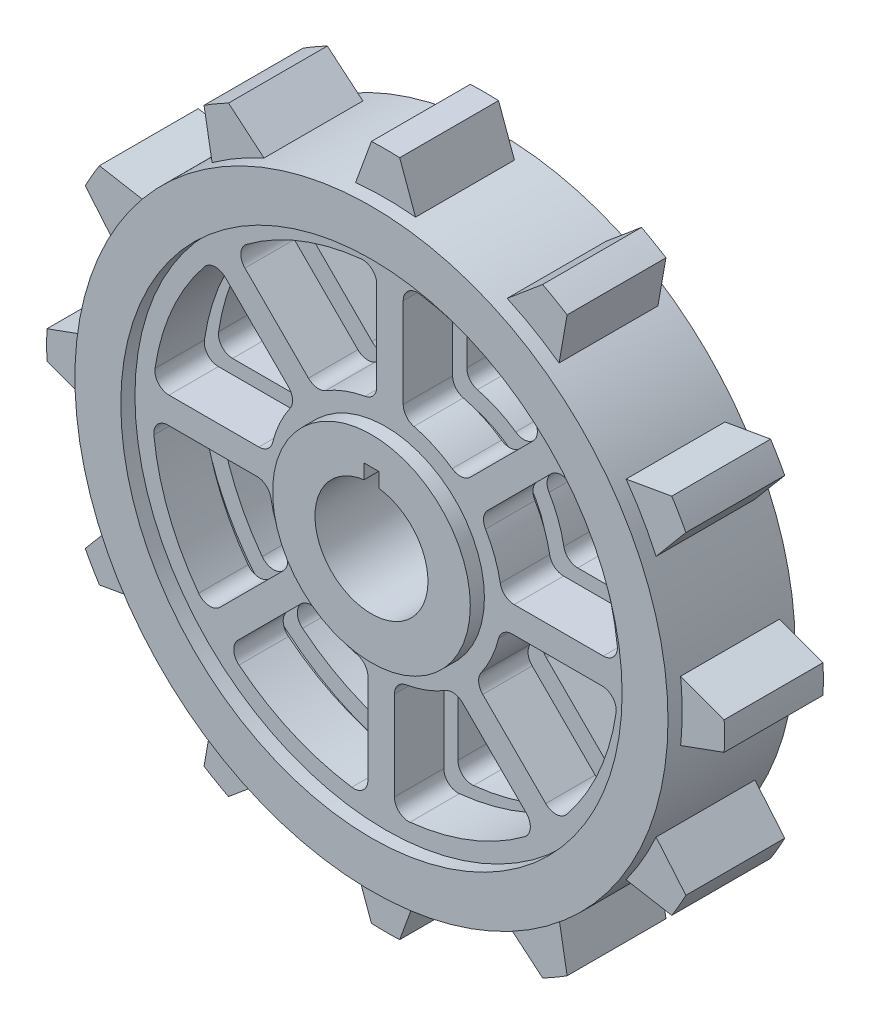
from build123d import *

# Parameters (mm, degrees)
SKETCH3_R                = 21
BOSS_EXTRUDE2_DEPTH      = 4.5
CUT_EXTRUDE1_DEPTH       = 32.032241298
SKETCH5_R                = 17.75
SKETCH5_R_2              = 7
CUT_EXTRUDE5_DEPTH       = 1
SKETCH6_R                = 17.75
SKETCH6_R_2              = 7
CUT_EXTRUDE6_DEPTH       = 1
CUT_EXTRUDE7_DEPTH       = 31.757112998
FILLET1_R                = 1
CIRPATTERN1_COUNT        = 8
FILLET1_OF_CIRPATTERN1_R = 1
BOSS_EXTRUDE3_DEPTH      = 7
CIRPATTERN2_COUNT        = 12


with BuildPart() as part:
    # Sketch3 → Boss-Extrude2 (new, symmetric)
    with BuildSketch(Plane.XY):
        Circle(SKETCH3_R)
    extrude(amount=BOSS_EXTRUDE2_DEPTH, both=True)

    # Sketch4 → Cut-Extrude1 (cut, through all)
    with BuildSketch(Plane.XY.offset(4.5)):
        with BuildLine():
            Line((-0.525, 5), (-0.525, 3.965397206))
            ThreePointArc((-0.525, 3.965397206), (0, -4), (0.525, 3.965397206))
            Line((0.525, 3.965397206), (0.525, 5))
            Line((0.525, 5), (-0.525, 5))
        make_face()
    extrude(amount=-CUT_EXTRUDE1_DEPTH, mode=Mode.SUBTRACT)

    # Sketch5 → Cut-Extrude5 (cut)
    with BuildSketch(Plane.XY):
        Circle(SKETCH5_R)
        Circle(SKETCH5_R_2, mode=Mode.SUBTRACT)
    extrude(amount=-CUT_EXTRUDE5_DEPTH, mode=Mode.SUBTRACT)

    # Sketch6 → Cut-Extrude6 (cut)
    with BuildSketch(Plane.XY.offset(4.5)):
        Circle(SKETCH6_R)
        Circle(SKETCH6_R_2, mode=Mode.SUBTRACT)
    cut_extrude6 = extrude(amount=-CUT_EXTRUDE6_DEPTH, mode=Mode.SUBTRACT)

    # Mirror2: Cut-Extrude6 across plane
    add(cut_extrude6.mirror(Plane.XY), mode=Mode.SUBTRACT)

    # Sketch7 → Cut-Extrude7 (cut, through all)
    with BuildSketch(Plane.XY.offset(3.5)):
        with BuildLine():
            ThreePointArc((11.216947038, 12.100830515), (6.602320075, 15.121487018), (1.25, 16.452583384))
            Line((1.25, 16.452583384), (1.25, 8.154753215))
            ThreePointArc((1.25, 8.154753215), (3.445440348, 7.496095037), (5.374924901, 6.258808378))
            Line((5.374924901, 6.258808378), (11.216947038, 12.100830515))
        make_face()
    cut_extrude7 = extrude(amount=-CUT_EXTRUDE7_DEPTH, mode=Mode.SUBTRACT)

    # Fillet1
    fillet1_edges = [part.edges().sort_by_distance(p)[0] for p in [
        (1.25, 16.452583384, -2.25),
        (1.25, 16.452583384, 1.75),
        (11.216947038, 12.100830515, 1.75),
        (11.216947038, 12.100830515, -2.25),
        (5.374924901, 6.258808378, 1.75),
        (5.374924901, 6.258808378, -2.25),
        (1.25, 8.154753215, -2.25),
        (1.25, 8.154753215, 1.75),
    ]]
    fillet(fillet1_edges, radius=FILLET1_R)

    # CirPattern1: Cut-Extrude7 ×8 about axis
    cirpattern1_axis = Axis((0, 0, 4.5), (0, 0, 1))
    for i in range(1, CIRPATTERN1_COUNT):
        add(cut_extrude7.rotate(cirpattern1_axis, i * 360 / CIRPATTERN1_COUNT), mode=Mode.SUBTRACT)

    # Fillet1 of CirPattern1
    fillet1_of_cirpattern1_edges = [part.edges().sort_by_distance(p)[0] for p in [
        (-10.749849802, 12.517616755, -2.25),
        (-10.749849802, 12.517616755, 1.75),
        (-0.625, 16.48815863, 1.75),
        (-0.625, 16.48815863, -2.25),
        (-0.625, 8.226291692, 1.75),
        (-0.625, 8.226291692, -2.25),
        (-4.882397821, 6.650164774, -2.25),
        (-4.882397821, 6.650164774, 1.75),
        (-16.452583384, 1.25, -2.25),
        (-16.452583384, 1.25, 1.75),
        (-12.100830515, 11.216947038, 1.75),
        (-12.100830515, 11.216947038, -2.25),
        (-6.258808378, 5.374924901, 1.75),
        (-6.258808378, 5.374924901, -2.25),
        (-8.154753215, 1.25, -2.25),
        (-8.154753215, 1.25, 1.75),
        (-12.517616755, -10.749849802, -2.25),
        (-12.517616755, -10.749849802, 1.75),
        (-16.48815863, -0.625, 1.75),
        (-16.48815863, -0.625, -2.25),
        (-8.226291692, -0.625, 1.75),
        (-8.226291692, -0.625, -2.25),
        (-6.650164774, -4.882397821, -2.25),
        (-6.650164774, -4.882397821, 1.75),
        (-1.25, -16.452583384, -2.25),
        (-1.25, -16.452583384, 1.75),
        (-11.216947038, -12.100830515, 1.75),
        (-11.216947038, -12.100830515, -2.25),
        (-5.374924901, -6.258808378, 1.75),
        (-5.374924901, -6.258808378, -2.25),
        (-1.25, -8.154753215, -2.25),
        (-1.25, -8.154753215, 1.75),
        (10.749849802, -12.517616755, -2.25),
        (10.749849802, -12.517616755, 1.75),
        (0.625, -16.48815863, 1.75),
        (0.625, -16.48815863, -2.25),
        (0.625, -8.226291692, 1.75),
        (0.625, -8.226291692, -2.25),
        (4.882397821, -6.650164774, -2.25),
        (4.882397821, -6.650164774, 1.75),
        (16.452583384, -1.25, -2.25),
        (16.452583384, -1.25, 1.75),
        (12.100830515, -11.216947038, 1.75),
        (12.100830515, -11.216947038, -2.25),
        (6.258808378, -5.374924901, 1.75),
        (6.258808378, -5.374924901, -2.25),
        (8.154753215, -1.25, -2.25),
        (8.154753215, -1.25, 1.75),
        (12.517616755, 10.749849802, -2.25),
        (12.517616755, 10.749849802, 1.75),
        (16.48815863, 0.625, 1.75),
        (16.48815863, 0.625, -2.25),
        (8.226291692, 0.625, 1.75),
        (8.226291692, 0.625, -2.25),
        (6.650164774, 4.882397821, -2.25),
        (6.650164774, 4.882397821, 1.75),
    ]]
    fillet(fillet1_of_cirpattern1_edges, radius=FILLET1_OF_CIRPATTERN1_R)

    # Sketch8 → Boss-Extrude3 (add)
    with BuildSketch(Plane.XY.offset(3.5)):
        with BuildLine():
            Line((-1, 23.979157617), (-2.123502172, 20.89236077))
            ThreePointArc((-2.123502172, 20.89236077), (0, 21), (2.123502172, 20.89236077))
            Line((2.123502172, 20.89236077), (1, 23.979157617))
            ThreePointArc((1, 23.979157617), (0, 24), (-1, 23.979157617))
        make_face()
    boss_extrude3 = extrude(amount=-BOSS_EXTRUDE3_DEPTH)

    # CirPattern2: Boss-Extrude3 ×12 about axis
    cirpattern2_axis = Axis((0, 0, 4.5), (0, 0, 1))
    for i in range(1, CIRPATTERN2_COUNT):
        add(boss_extrude3.rotate(cirpattern2_axis, i * 360 / CIRPATTERN2_COUNT))


solid = part.part
